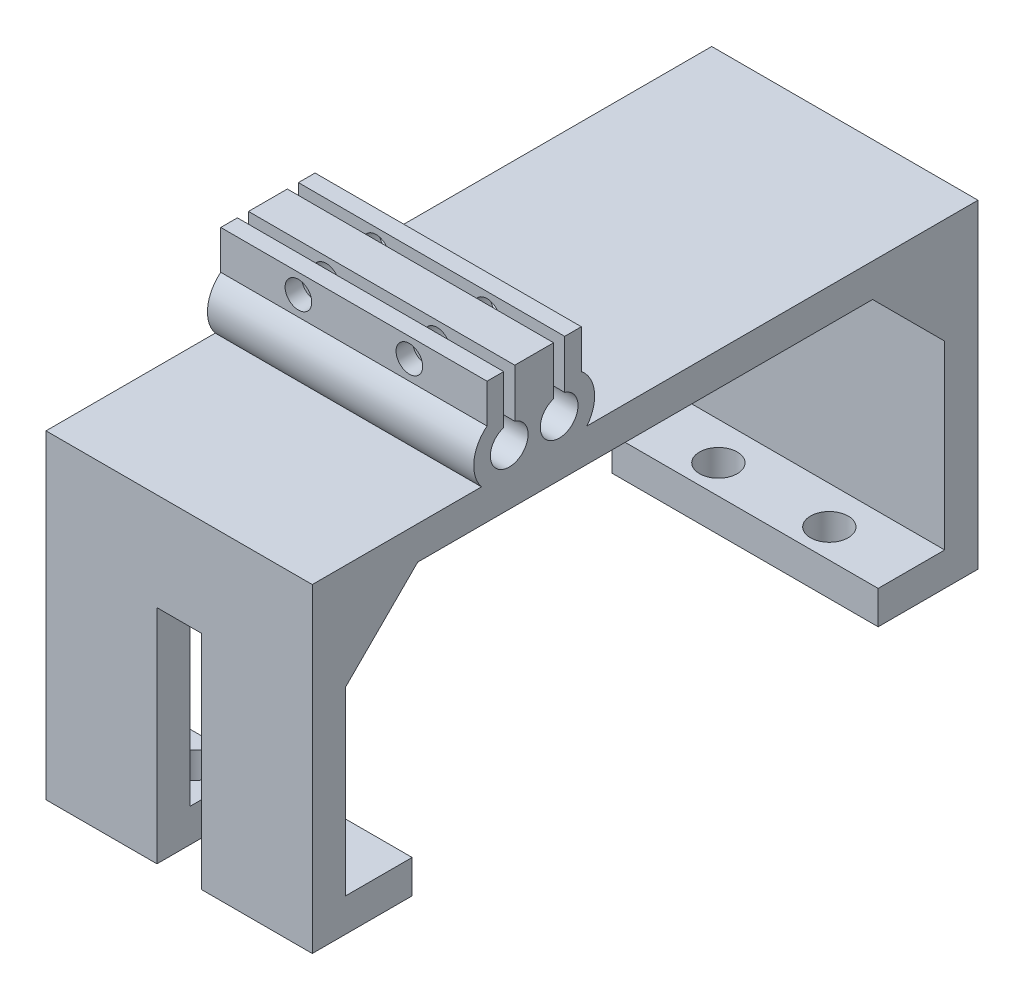
from build123d import *

# Parameters (mm, degrees)
SKETCH1_W           = 24
SKETCH1_H           = 60
BOSS_EXTRUDE1_DEPTH = 36.8
CUT_EXTRUDE1_DEPTH  = 54.2
CUT_EXTRUDE2_DEPTH  = 54.2
SKETCH4_R           = 1.2
CUT_EXTRUDE3_DEPTH  = 53.690630097
SKETCH5_W           = 54
SKETCH5_H           = 25.8
CUT_EXTRUDE4_DEPTH  = 54.2
SKETCH6_W           = 24
SKETCH6_H           = 3
BOSS_EXTRUDE2_DEPTH = 9
SKETCH7_W           = 24
SKETCH7_H           = 3
BOSS_EXTRUDE3_DEPTH = 9
SKETCH8_R           = 1.7
CUT_EXTRUDE5_DEPTH  = 6
SKETCH9_W           = 4
SKETCH9_H           = 20
CUT_EXTRUDE6_DEPTH  = 17
CHAMFER1_SIZE       = 6.5


with BuildPart() as part:
    # Sketch1 → Boss-Extrude1 (new body)
    with BuildSketch(Plane(origin=(0, 0, 0), x_dir=(1, 0, 0), z_dir=(0, 1, 0))):
        Rectangle(SKETCH1_W, SKETCH1_H)
    extrude(amount=BOSS_EXTRUDE1_DEPTH)

    # Sketch2 → Cut-Extrude1 (cut, through all)
    with BuildSketch(Plane(origin=(12, 0, 0), x_dir=(0, 0, -1), z_dir=(1, 0, 0))):
        with BuildLine():
            Line((-12.75, 36.8), (-12.75, 32.424807681))
            ThreePointArc((-12.75, 32.424807681), (-12.25, 29.1), (-11.75, 32.424807681))
            Line((-11.75, 32.424807681), (-11.75, 36.8))
            Line((-11.75, 36.8), (-12.75, 36.8))
        make_face()
        with BuildLine():
            Line((-8.25, 32.424807681), (-8.25, 36.8))
            Line((-8.25, 36.8), (-7.25, 36.8))
            Line((-7.25, 36.8), (-7.25, 32.424807681))
            ThreePointArc((-7.25, 32.424807681), (-7.75, 29.1), (-8.25, 32.424807681))
        make_face()
    extrude(amount=-CUT_EXTRUDE1_DEPTH, mode=Mode.SUBTRACT)

    # Sketch3 → Cut-Extrude2 (cut, through all)
    with BuildSketch(Plane(origin=(12, 0, 0), x_dir=(0, 0, -1), z_dir=(1, 0, 0))):
        with BuildLine():
            Line((-14.25, 36.8), (-14.25, 33.297999199))
            ThreePointArc((-14.25, 33.297999199), (-15.430565736, 31.152138611), (-14.747999199, 28.8))
            Line((-14.747999199, 28.8), (-30, 28.8))
            Line((-30, 28.8), (-30, 36.8))
            Line((-30, 36.8), (-14.25, 36.8))
        make_face()
        with BuildLine():
            Line((30, 28.8), (30, 36.8))
            Line((30, 36.8), (-5.75, 36.8))
            Line((-5.75, 36.8), (-5.75, 33.297999199))
            ThreePointArc((-5.75, 33.297999199), (-4.569434264, 31.152138611), (-5.252000801, 28.8))
            Line((-5.252000801, 28.8), (30, 28.8))
        make_face()
    extrude(amount=-CUT_EXTRUDE2_DEPTH, mode=Mode.SUBTRACT)

    # Sketch4 → Cut-Extrude3 (cut, through all)
    with BuildSketch(Plane(origin=(0, 0, 5.75), x_dir=(-1, 0, 0), z_dir=(0, 0, -1))):
        with Locations((-5, 35.0489996)):
            Circle(SKETCH4_R)
        with Locations((5, 35.0489996)):
            Circle(SKETCH4_R)
    extrude(amount=-CUT_EXTRUDE3_DEPTH, mode=Mode.SUBTRACT)

    # Sketch5 → Cut-Extrude4 (cut, through all)
    with BuildSketch(Plane(origin=(12, 0, 0), x_dir=(0, 0, -1), z_dir=(1, 0, 0))):
        with Locations((0, 12.9)):
            Rectangle(SKETCH5_W, SKETCH5_H)
    extrude(amount=-CUT_EXTRUDE4_DEPTH, mode=Mode.SUBTRACT)

    # Sketch6 → Boss-Extrude2 (add)
    with BuildSketch(Plane(origin=(0, 0, -30), x_dir=(-1, 0, 0), z_dir=(0, 0, -1))):
        with Locations((0, 1.5)):
            Rectangle(SKETCH6_W, SKETCH6_H)
    extrude(amount=-BOSS_EXTRUDE2_DEPTH)

    # Sketch7 → Boss-Extrude3 (add)
    with BuildSketch(Plane.XY.offset(30)):
        with Locations((0, 1.5)):
            Rectangle(SKETCH7_W, SKETCH7_H)
    extrude(amount=-BOSS_EXTRUDE3_DEPTH)

    # Sketch8 → Cut-Extrude5 (cut)
    with BuildSketch(Plane(origin=(0, 3, 0), x_dir=(1, 0, 0), z_dir=(0, 1, 0))):
        with Locations(Location((-5, 23.6, 0), (0, 0, 180))):
            Circle(SKETCH8_R)
        with Locations(Location((5, 23.6, 0), (0, 0, 180))):
            Circle(SKETCH8_R)
        with Locations(Location((-5, -23.6, 0), (0, 0, 180))):
            Circle(SKETCH8_R)
        with Locations(Location((5, -23.6, 0), (0, 0, 180))):
            Circle(SKETCH8_R)
    extrude(amount=-CUT_EXTRUDE5_DEPTH, mode=Mode.SUBTRACT)

    # Sketch9 → Cut-Extrude6 (cut)
    with BuildSketch(Plane.XY.offset(30)):
        with Locations((0, 10)):
            Rectangle(SKETCH9_W, SKETCH9_H)
    extrude(amount=-CUT_EXTRUDE6_DEPTH, mode=Mode.SUBTRACT)

    # Chamfer1
    # the kernel refuses this chamfer: 6.5 mm, written as the material it adds along each edge
    with BuildSketch(Plane(origin=(12, 25.8, -27), x_dir=(0, -0.9996219169112968, -0.027495876610587486), z_dir=(-1, 0, 0))) as chamfer1_piece_1:
        Polygon((CHAMFER1_SIZE * 0.999621916911, CHAMFER1_SIZE * 0.0274958766106), (-CHAMFER1_SIZE * 0.0274958766106, CHAMFER1_SIZE * 0.999621916911), (0, 0), align=None)
    extrude(amount=24)
    with BuildSketch(Plane(origin=(12, 25.8, 27), x_dir=(0, -0.9996219169112968, 0.027495876610586424), z_dir=(-1, 0, 0))) as chamfer1_piece_2_section:
        Polygon((CHAMFER1_SIZE * 0.999621916911, -CHAMFER1_SIZE * 0.0274958766106), (-CHAMFER1_SIZE * 0.0274958766106, -CHAMFER1_SIZE * 0.999621916911), (0, 0), align=None)
    chamfer1_piece_2 = extrude(amount=24, mode=Mode.PRIVATE)
    chamfer1_piece_2 = split(chamfer1_piece_2, bisect_by=Plane(origin=(7, 20, 26.950497718), z_dir=(0, -1, 0)), keep=Keep.TOP, mode=Mode.PRIVATE)
    chamfer1_piece_2 = split(chamfer1_piece_2, bisect_by=Plane(origin=(2, 19.670055839, 26.950497718), z_dir=(1, 0, 0)), keep=Keep.TOP, mode=Mode.PRIVATE)
    add(chamfer1_piece_2)
    with BuildSketch(Plane(origin=(12, 25.8, 27), x_dir=(0, -0.9996219169112968, 0.027495876610586424), z_dir=(-1, 0, 0))) as chamfer1_piece_3_section:
        Polygon((CHAMFER1_SIZE * 0.999621916911, -CHAMFER1_SIZE * 0.0274958766106), (-CHAMFER1_SIZE * 0.0274958766106, -CHAMFER1_SIZE * 0.999621916911), (0, 0), align=None)
    chamfer1_piece_3 = extrude(amount=24, mode=Mode.PRIVATE)
    chamfer1_piece_3 = split(chamfer1_piece_3, bisect_by=Plane(origin=(7, 20, 24.812647942), z_dir=(0, 1, 0)), keep=Keep.TOP, mode=Mode.PRIVATE)
    chamfer1_piece_3 = split(chamfer1_piece_3, bisect_by=Plane(origin=(2, 23.739513204, 24.812647942), z_dir=(1, 0, 0)), keep=Keep.TOP, mode=Mode.PRIVATE)
    add(chamfer1_piece_3)
    with BuildSketch(Plane(origin=(12, 25.8, 27), x_dir=(0, -0.9996219169112968, 0.027495876610586424), z_dir=(-1, 0, 0))) as chamfer1_piece_4_section:
        Polygon((CHAMFER1_SIZE * 0.999621916911, -CHAMFER1_SIZE * 0.0274958766106), (-CHAMFER1_SIZE * 0.0274958766106, -CHAMFER1_SIZE * 0.999621916911), (0, 0), align=None)
    chamfer1_piece_4 = extrude(amount=24, mode=Mode.PRIVATE)
    chamfer1_piece_4 = split(chamfer1_piece_4, bisect_by=Plane(origin=(-2, 23.739513204, 24.812647942), z_dir=(1, 0, 0)), keep=Keep.TOP, mode=Mode.PRIVATE)
    chamfer1_piece_4 = split(chamfer1_piece_4, bisect_by=Plane(origin=(0, 20, 24.812647942), z_dir=(0, 1, 0)), keep=Keep.TOP, mode=Mode.PRIVATE)
    chamfer1_piece_4 = split(chamfer1_piece_4, bisect_by=Plane(origin=(2, 23.739513204, 24.812647942), z_dir=(-1, 0, 0)), keep=Keep.TOP, mode=Mode.PRIVATE)
    add(chamfer1_piece_4)
    with BuildSketch(Plane(origin=(12, 25.8, 27), x_dir=(0, -0.9996219169112968, 0.027495876610586424), z_dir=(-1, 0, 0))) as chamfer1_piece_5_section:
        Polygon((CHAMFER1_SIZE * 0.999621916911, -CHAMFER1_SIZE * 0.0274958766106), (-CHAMFER1_SIZE * 0.0274958766106, -CHAMFER1_SIZE * 0.999621916911), (0, 0), align=None)
    chamfer1_piece_5 = extrude(amount=24, mode=Mode.PRIVATE)
    chamfer1_piece_5 = split(chamfer1_piece_5, bisect_by=Plane(origin=(-2, 19.670055839, 26.950497718), z_dir=(-1, 0, 0)), keep=Keep.TOP, mode=Mode.PRIVATE)
    chamfer1_piece_5 = split(chamfer1_piece_5, bisect_by=Plane(origin=(-7, 20, 26.950497718), z_dir=(0, -1, 0)), keep=Keep.TOP, mode=Mode.PRIVATE)
    add(chamfer1_piece_5)
    with BuildSketch(Plane(origin=(12, 25.8, 27), x_dir=(0, -0.9996219169112968, 0.027495876610586424), z_dir=(-1, 0, 0))) as chamfer1_piece_6_section:
        Polygon((CHAMFER1_SIZE * 0.999621916911, -CHAMFER1_SIZE * 0.0274958766106), (-CHAMFER1_SIZE * 0.0274958766106, -CHAMFER1_SIZE * 0.999621916911), (0, 0), align=None)
    chamfer1_piece_6 = extrude(amount=24, mode=Mode.PRIVATE)
    chamfer1_piece_6 = split(chamfer1_piece_6, bisect_by=Plane(origin=(-2, 23.739513204, 24.812647942), z_dir=(-1, 0, 0)), keep=Keep.TOP, mode=Mode.PRIVATE)
    chamfer1_piece_6 = split(chamfer1_piece_6, bisect_by=Plane(origin=(-7, 20, 24.812647942), z_dir=(0, 1, 0)), keep=Keep.TOP, mode=Mode.PRIVATE)
    add(chamfer1_piece_6)


solid = part.part
